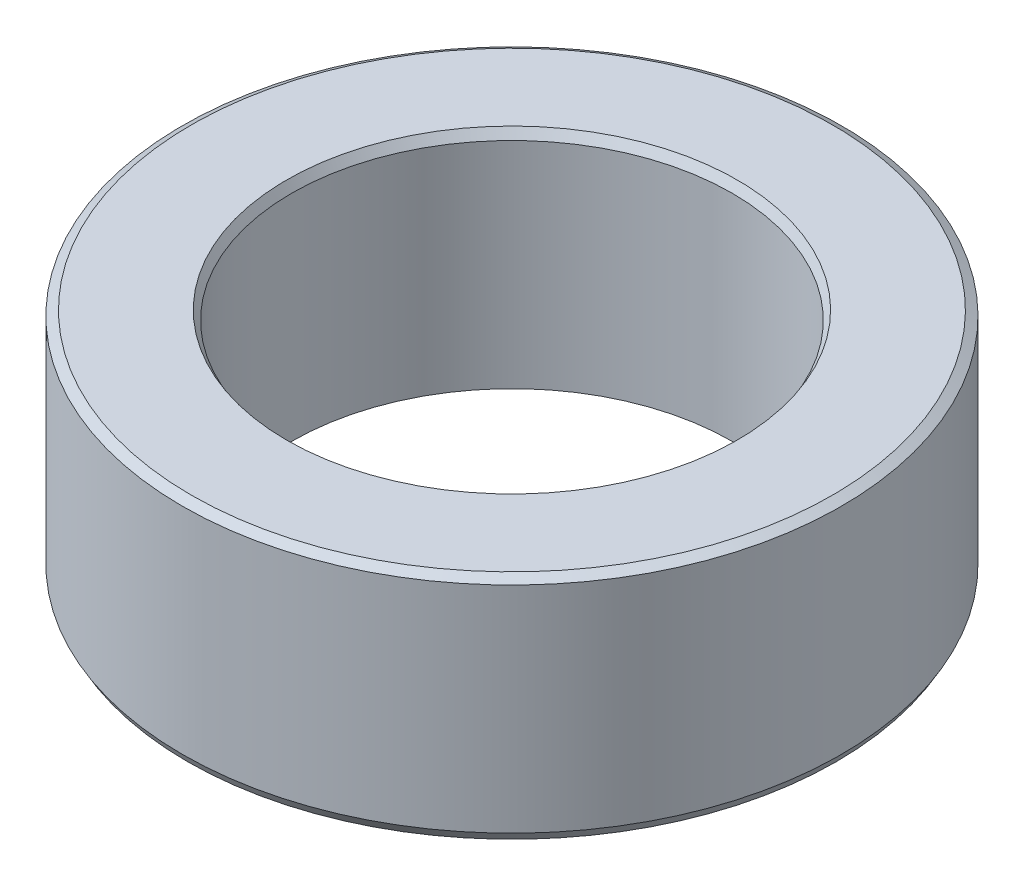
from build123d import *
from OCP.BRepFilletAPI import BRepFilletAPI_MakeChamfer

# Parameters (mm, degrees)
SKETCH1_R           = 32.5
BOSS_EXTRUDE1_DEPTH = 22.577720124
SKETCH2_R           = 21.715429643
CUT_EXTRUDE1_DEPTH  = 52.207943192
CHAMFER1_SIZE       = 0.506102964
CHAMFER1_SIZE2      = 0.876596048


with BuildPart() as part:
    # Sketch1 → Boss-Extrude1 (new body)
    with BuildSketch(Plane(origin=(0, 0, 0), x_dir=(1, 0, 0), z_dir=(0, 1, 0))):
        Circle(SKETCH1_R)
    extrude(amount=BOSS_EXTRUDE1_DEPTH)

    # Sketch2 → Cut-Extrude1 (cut, through all)
    with BuildSketch(Plane(origin=(0, 0, 0), x_dir=(1, 0, 0), z_dir=(0, 1, 0))):
        Circle(SKETCH2_R)
    extrude(amount=CUT_EXTRUDE1_DEPTH, mode=Mode.SUBTRACT)

    # Chamfer1: one chamfer whose edges measure the first distance from different faces: ONE call of the kernel's chamfer builder (chamfer() names one face for all edges)
    chamfer1_edges_1 = [part.edges().sort_by_distance(p)[0] for p in [
        (-21.715429643, 22.577720124, 0),
    ]]
    chamfer1_side_1 = [part.faces().sort_by_distance(p)[0] for p in [
        (-31.580761184, 22.577720124, 0),
    ]]
    chamfer1_edges_2 = [part.edges().sort_by_distance(p)[0] for p in [
        (-21.715429643, 0, 0),
    ]]
    chamfer1_side_2 = [part.faces().sort_by_distance(p)[0] for p in [
        (-21.715429643, 11.288860062, 0),
    ]]
    chamfer1_edges_3 = [part.edges().sort_by_distance(p)[0] for p in [
        (-32.5, 0, 0),
    ]]
    chamfer1_side_3 = [part.faces().sort_by_distance(p)[0] for p in [
        (-31.580761184, 0, 0),
    ]]
    chamfer1_edges_4 = [part.edges().sort_by_distance(p)[0] for p in [
        (-32.5, 22.577720124, 0),
    ]]
    chamfer1_side_4 = [part.faces().sort_by_distance(p)[0] for p in [
        (-32.5, 11.288860062, 0),
    ]]
    chamfer1 = BRepFilletAPI_MakeChamfer(part.part.solid().wrapped)
    for e in chamfer1_edges_1:
        chamfer1.Add(CHAMFER1_SIZE, CHAMFER1_SIZE2, e.wrapped, chamfer1_side_1[0].wrapped)  # the first distance lies on this face
    for e in chamfer1_edges_2:
        chamfer1.Add(CHAMFER1_SIZE, CHAMFER1_SIZE2, e.wrapped, chamfer1_side_2[0].wrapped)  # the first distance lies on this face
    for e in chamfer1_edges_3:
        chamfer1.Add(CHAMFER1_SIZE, CHAMFER1_SIZE2, e.wrapped, chamfer1_side_3[0].wrapped)  # the first distance lies on this face
    for e in chamfer1_edges_4:
        chamfer1.Add(CHAMFER1_SIZE, CHAMFER1_SIZE2, e.wrapped, chamfer1_side_4[0].wrapped)  # the first distance lies on this face
    add(Compound.cast(chamfer1.Shape()), mode=Mode.REPLACE)


solid = part.part
